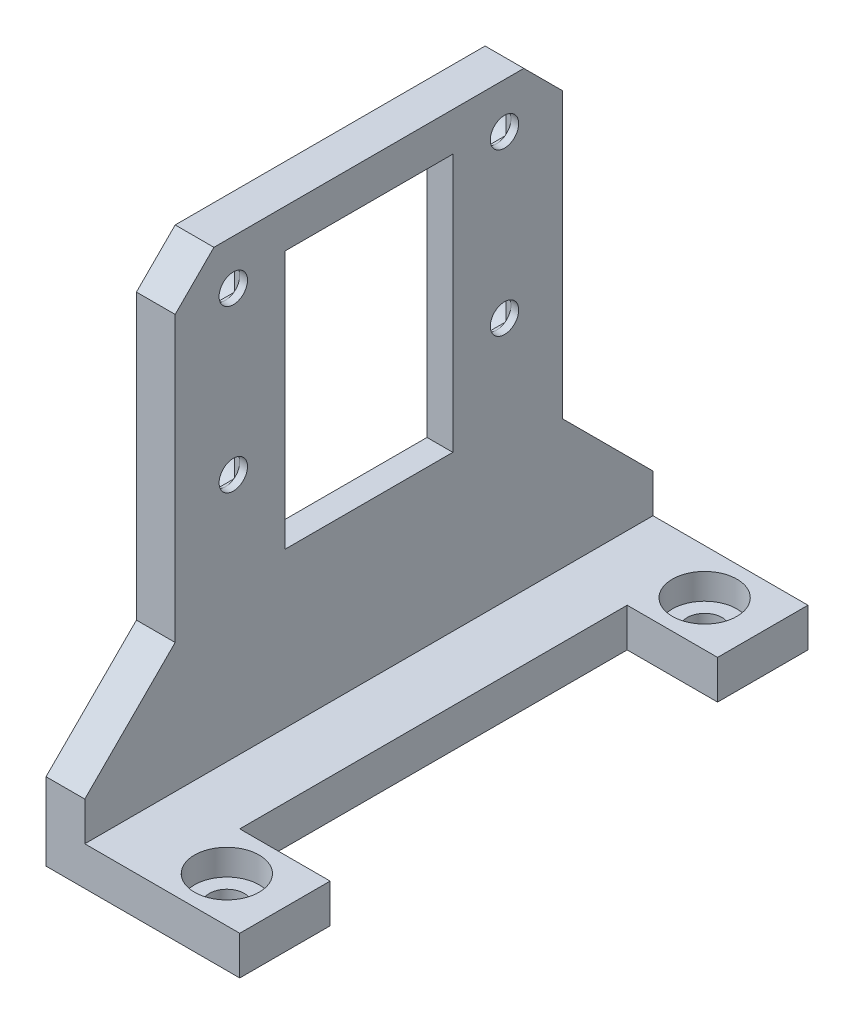
from build123d import *
from build123d.topology import SkipClean

# Parameters (mm, degrees)
BOSS_EXTRUDE1_DEPTH = 3
SKETCH2_R           = 1.35
CUT_EXTRUDE1_DEPTH  = 27.795522014
SKETCH3_R           = 2.5
CUT_EXTRUDE2_DEPTH  = 2
SKETCH4_W           = 3
SKETCH4_H           = 30
BOSS_EXTRUDE2_DEPTH = 35
SKETCH5_R           = 1.1
CUT_EXTRUDE3_DEPTH  = 47.400431032
SKETCH6_W           = 13
SKETCH6_H           = 20
CUT_EXTRUDE4_DEPTH  = 47.400431032
CHAMFER1_SIZE       = 10
CHAMFER2_SIZE       = 1
CHAMFER3_SIZE       = 3
SKETCH7_R           = 2
CUT_EXTRUDE5_DEPTH  = 2
CUT_EXTRUDE6_DEPTH  = 0.2
SKETCH9_W           = 2.2
SKETCH9_H           = 2.2
CUT_EXTRUDE7_DEPTH  = 0.2


with BuildPart() as part:
    # Sketch1 → Boss-Extrude1 (new body)
    with BuildSketch(Plane(origin=(0, 0, 0), x_dir=(1, 0, 0), z_dir=(0, 1, 0))):
        Polygon((0, -22), (0, 22), (15, 22), (15, 15), (8, 15), (8, -15), (15, -15), (15, -22), align=None)
    extrude(amount=BOSS_EXTRUDE1_DEPTH)

    # Sketch2 → Cut-Extrude1 (cut, through all)
    with BuildSketch(Plane(origin=(0, 3, 0), x_dir=(1, 0, 0), z_dir=(0, 1, 0))):
        with Locations(Location((10.5, 18.5, 0), (0, 0, 270))):
            Circle(SKETCH2_R)
        with Locations(Location((10.5, -18.5, 0), (0, 0, 270))):
            Circle(SKETCH2_R)
    extrude(amount=-CUT_EXTRUDE1_DEPTH, mode=Mode.SUBTRACT)

    # Sketch3 → Cut-Extrude2 (cut)
    with BuildSketch(Plane(origin=(0, 3, 0), x_dir=(1, 0, 0), z_dir=(0, 1, 0))):
        with Locations(Location((10.5, 18.5, 0), (0, 0, 270))):
            Circle(SKETCH3_R)
        with Locations(Location((10.5, -18.5, 0), (0, 0, 270))):
            Circle(SKETCH3_R)
    extrude(amount=-CUT_EXTRUDE2_DEPTH, mode=Mode.SUBTRACT)

    # Sketch4 → Boss-Extrude2 (add)
    with BuildSketch(Plane(origin=(0, 3, 0), x_dir=(1, 0, 0), z_dir=(0, 1, 0))):
        with Locations((1.5, 0)):
            Rectangle(SKETCH4_W, SKETCH4_H)
    extrude(amount=BOSS_EXTRUDE2_DEPTH)

    # Sketch5 → Cut-Extrude3 (cut, through all)
    with BuildSketch(Plane.ZY):
        with Locations((-10.5, 34.5)):
            Circle(SKETCH5_R)
        with Locations((10.5, 34.5)):
            Circle(SKETCH5_R)
        with Locations((10.5, 22)):
            Circle(SKETCH5_R)
        with Locations((-10.5, 22)):
            Circle(SKETCH5_R)
    extrude(amount=-CUT_EXTRUDE3_DEPTH, mode=Mode.SUBTRACT)

    # Sketch6 → Cut-Extrude4 (cut, through all)
    with BuildSketch(Plane.ZY):
        with Locations((0, 25)):
            Rectangle(SKETCH6_W, SKETCH6_H)
    extrude(amount=-CUT_EXTRUDE4_DEPTH, mode=Mode.SUBTRACT)

    # Chamfer1
    # the kernel refuses this chamfer: 10 mm, written as the material it adds along each edge
    with BuildSketch(Plane(origin=(0, 3, -15), x_dir=(0, -0.02749587661058636, -0.9996219169112968), z_dir=(1, 0, 0))) as chamfer1_piece_1_section:
        Polygon((CHAMFER1_SIZE * 0.999621916911, CHAMFER1_SIZE * 0.0274958766106), (-CHAMFER1_SIZE * 0.0274958766106, CHAMFER1_SIZE * 0.999621916911), (0, 0), align=None)
    chamfer1_piece_1 = extrude(amount=3, mode=Mode.PRIVATE)
    chamfer1_piece_1 = split(chamfer1_piece_1, bisect_by=Plane(origin=(1.5, 6.564102564, -22), z_dir=(0, 0, 1)), keep=Keep.TOP, mode=Mode.PRIVATE)
    add(chamfer1_piece_1)
    with BuildSketch(Plane(origin=(3, 3, 15), x_dir=(0, -0.02749587661058636, 0.9996219169112968), z_dir=(-1, 0, 0))) as chamfer1_piece_2_section:
        Polygon((CHAMFER1_SIZE * 0.999621916911, CHAMFER1_SIZE * 0.0274958766106), (-CHAMFER1_SIZE * 0.0274958766106, CHAMFER1_SIZE * 0.999621916911), (0, 0), align=None)
    chamfer1_piece_2 = extrude(amount=3, mode=Mode.PRIVATE)
    chamfer1_piece_2 = split(chamfer1_piece_2, bisect_by=Plane(origin=(1.5, 6.564102564, 22), z_dir=(0, 0, -1)), keep=Keep.TOP, mode=Mode.PRIVATE)
    add(chamfer1_piece_2)

    # Chamfer2
    chamfer2_edges = [part.edges().sort_by_distance(p)[0] for p in [
        (0, 25, -6.5),
        (0, 15, 0),
        (0, 25, 6.5),
        (0, 35, 0),
    ]]
    chamfer(chamfer2_edges, length=CHAMFER2_SIZE)

    # Chamfer3
    chamfer3_edges = [part.edges().sort_by_distance(p)[0] for p in [
        (1.5, 38, 15),
        (1.5, 38, -15),
    ]]
    chamfer(chamfer3_edges, length=CHAMFER3_SIZE)

    # Sketch7 → Cut-Extrude5 (cut)
    with BuildSketch(Plane.ZY):
        with Locations((-10.5, 34.5)):
            Circle(SKETCH7_R)
        with Locations((10.5, 34.5)):
            Circle(SKETCH7_R)
        with Locations((10.5, 22)):
            Circle(SKETCH7_R)
        with Locations((-10.5, 22)):
            Circle(SKETCH7_R)
    extrude(amount=-CUT_EXTRUDE5_DEPTH, mode=Mode.SUBTRACT)

    # Sketch8 → Cut-Extrude6 (cut)
    with SkipClean():  # the faces are left unmerged after this step: merging them gives an invalid solid
        with BuildSketch(Plane.ZY.offset(-2)):
            with BuildLine():
                Line((-11.6, 32.829670691), (-11.6, 36.170329309))
                ThreePointArc((-11.6, 36.170329309), (-10.5, 36.5), (-9.4, 36.170329309))
                Line((-9.4, 36.170329309), (-9.4, 32.829670691))
                ThreePointArc((-9.4, 32.829670691), (-10.5, 32.5), (-11.6, 32.829670691))
            make_face()
            with BuildLine():
                Line((-11.6, 20.329670691), (-11.6, 23.670329309))
                ThreePointArc((-11.6, 23.670329309), (-10.5, 24), (-9.4, 23.670329309))
                Line((-9.4, 23.670329309), (-9.4, 20.329670691))
                ThreePointArc((-9.4, 20.329670691), (-10.5, 20), (-11.6, 20.329670691))
            make_face()
        cut_extrude6 = extrude(amount=-CUT_EXTRUDE6_DEPTH, mode=Mode.SUBTRACT)

    # Sketch9 → Cut-Extrude7 (cut)
    with SkipClean():  # the faces are left unmerged after this step: merging them gives an invalid solid
        with BuildSketch(Plane.ZY.offset(-2.2)):
            with Locations((-10.5, 22)):
                Rectangle(SKETCH9_W, SKETCH9_H)
            with Locations((-10.5, 34.5)):
                Rectangle(SKETCH9_W, SKETCH9_H)
        cut_extrude7 = extrude(amount=-CUT_EXTRUDE7_DEPTH, mode=Mode.SUBTRACT)

    # Mirror1: Cut-Extrude6, Cut-Extrude7 across plane
    with SkipClean():  # the faces are left unmerged after this step: merging them gives an invalid solid
        add(cut_extrude6.mirror(Plane.XY), mode=Mode.SUBTRACT)
        add(cut_extrude7.mirror(Plane.XY), mode=Mode.SUBTRACT)


solid = part.part
